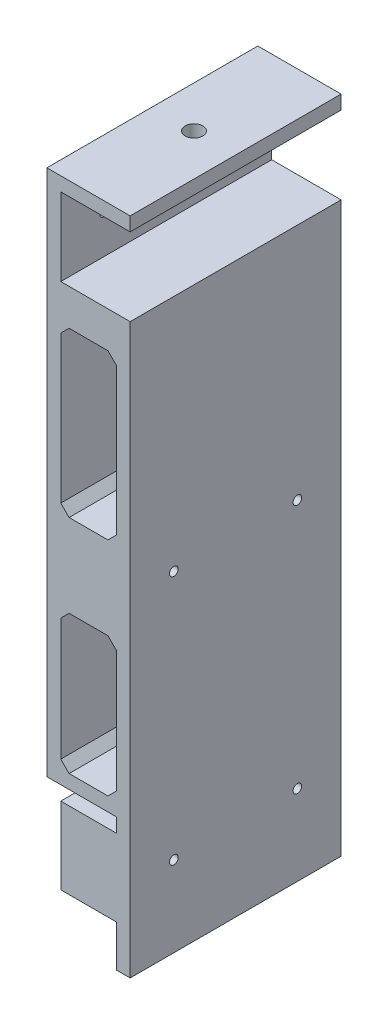
from build123d import *

# Parameters (mm, degrees)
EXTRUDE_1_DEPTH     = 76
CUT_EXTRUDE_1_REACH = 225.743
SKETCH_2_R          = 1.57
CUT_EXTRUDE_2_REACH = 225.743
SKETCH_3_R          = 1.57
CUT_EXTRUDE_3_REACH = 252.262
SKETCH_4_R          = 3.17
CUT_EXTRUDE_4_REACH = 226.356
SKETCH_6_R          = 1.57
CUT_EXTRUDE_5_REACH = 225.029
SKETCH_7_W          = 19.993575714
SKETCH_7_H          = 50
SKETCH_7_H_2        = 59.035578036
CHAMFER_1_SIZE      = 3
CHAMFER_2_SIZE      = 3
CHAMFER_3_SIZE      = 3
CHAMFER_4_SIZE      = 3
CHAMFER_5_SIZE      = 3
CHAMFER_6_SIZE      = 3
CHAMFER_7_SIZE      = 3
CHAMFER_8_SIZE      = 3


with BuildPart() as part:
    # 草图1 → 凸台-拉伸1 (new body)
    with BuildSketch(Plane.XY):
        Polygon((12.5, -13.85), (12.5, -28.85), (7.506424286, -28.85), (7.506424286, -13.85), (-12.5, -13.85), (-12.5, 13.85), (7.506424286, 13.85), (7.506424286, 18.95), (-17.493575714, 18.95), (-17.493575714, 208.95), (12.5, 208.95), (12.5, 203.95), (-12.493575714, 203.95), (-12.493575714, 175.95), (12.5, 175.95), (12.5, 18.95), (12.5, 13.85), align=None)
    extrude(amount=EXTRUDE_1_DEPTH)

    # 草图2 → 切除-拉伸1 (cut, up to next)
    with BuildSketch(Plane(origin=(-12.493575714, 0, 0), x_dir=(0, 0, -1), z_dir=(1, 0, 0)), mode=Mode.PRIVATE) as cut_extrude_1_sk1:
        with Locations((-60.4, 189.95)):
            Circle(SKETCH_2_R)
    cut_extrude_1_tool1 = extrude(cut_extrude_1_sk1.sketch, amount=-CUT_EXTRUDE_1_REACH, mode=Mode.PRIVATE) & part.part
    # 草图2 → 切除-拉伸1 (cut, up to next)
    with BuildSketch(Plane(origin=(-12.493575714, 0, 0), x_dir=(0, 0, -1), z_dir=(1, 0, 0)), mode=Mode.PRIVATE) as cut_extrude_1_sk2:
        with Locations((-15.6, 189.95)):
            Circle(SKETCH_2_R)
    cut_extrude_1_tool2 = extrude(cut_extrude_1_sk2.sketch, amount=-CUT_EXTRUDE_1_REACH, mode=Mode.PRIVATE) & part.part
    add(cut_extrude_1_tool1.solids().sort_by_distance((-12.493576, 189.95, 60.4))[0], mode=Mode.SUBTRACT)
    add(cut_extrude_1_tool2.solids().sort_by_distance((-12.493576, 189.95, 15.6))[0], mode=Mode.SUBTRACT)

    # 草图3 → 切除-拉伸2 (cut, up to next)
    with BuildSketch(Plane.ZY.offset(12.5), mode=Mode.PRIVATE) as cut_extrude_2_sk1:
        with Locations((15.75, 0.15)):
            Circle(SKETCH_3_R)
    cut_extrude_2_tool1 = extrude(cut_extrude_2_sk1.sketch, amount=-CUT_EXTRUDE_2_REACH, mode=Mode.PRIVATE) & part.part
    # 草图3 → 切除-拉伸2 (cut, up to next)
    with BuildSketch(Plane.ZY.offset(12.5), mode=Mode.PRIVATE) as cut_extrude_2_sk2:
        with Locations((60.25, 0.15)):
            Circle(SKETCH_3_R)
    cut_extrude_2_tool2 = extrude(cut_extrude_2_sk2.sketch, amount=-CUT_EXTRUDE_2_REACH, mode=Mode.PRIVATE) & part.part
    add(cut_extrude_2_tool1.solids().sort_by_distance((-12.5, 0.15, 15.75))[0], mode=Mode.SUBTRACT)
    add(cut_extrude_2_tool2.solids().sort_by_distance((-12.5, 0.15, 60.25))[0], mode=Mode.SUBTRACT)

    # 草图4 → 切除-拉伸3 (cut, up to next)
    with BuildSketch(Plane(origin=(0, 208.95, 0), x_dir=(1, 0, 0), z_dir=(0, 1, 0)), mode=Mode.PRIVATE) as cut_extrude_3_sk1:
        with Locations((-2.496787857, -38)):
            Circle(SKETCH_4_R)
    cut_extrude_3_tool1 = extrude(cut_extrude_3_sk1.sketch, amount=-CUT_EXTRUDE_3_REACH, mode=Mode.PRIVATE) & part.part
    add(cut_extrude_3_tool1.solids().sort_by_distance((-2.496788, 208.95, 38))[0], mode=Mode.SUBTRACT)

    # 草图6 → 切除-拉伸4 (cut, up to next)
    with BuildSketch(Plane.ZY.offset(17.493575714), mode=Mode.PRIVATE) as cut_extrude_4_sk1:
        with Locations((15.75, 90.15)):
            Circle(SKETCH_6_R)
    cut_extrude_4_tool1 = extrude(cut_extrude_4_sk1.sketch, amount=-CUT_EXTRUDE_4_REACH, mode=Mode.PRIVATE) & part.part
    # 草图6 → 切除-拉伸4 (cut, up to next)
    with BuildSketch(Plane.ZY.offset(17.493575714), mode=Mode.PRIVATE) as cut_extrude_4_sk2:
        with Locations((60.25, 90.15)):
            Circle(SKETCH_6_R)
    cut_extrude_4_tool2 = extrude(cut_extrude_4_sk2.sketch, amount=-CUT_EXTRUDE_4_REACH, mode=Mode.PRIVATE) & part.part
    add(cut_extrude_4_tool1.solids().sort_by_distance((-17.493576, 90.15, 15.75))[0], mode=Mode.SUBTRACT)
    add(cut_extrude_4_tool2.solids().sort_by_distance((-17.493576, 90.15, 60.25))[0], mode=Mode.SUBTRACT)

    # 草图7 → 切除-拉伸5 (cut, up to next)
    with BuildSketch(Plane.XY.offset(76), mode=Mode.PRIVATE) as cut_extrude_5_sk1:
        with Locations((-2.496787857, 48.95)):
            Rectangle(SKETCH_7_W, SKETCH_7_H)
    cut_extrude_5_tool1 = extrude(cut_extrude_5_sk1.sketch, amount=-CUT_EXTRUDE_5_REACH, mode=Mode.PRIVATE) & part.part
    # 草图7 → 切除-拉伸5 (cut, up to next)
    with BuildSketch(Plane.XY.offset(76), mode=Mode.PRIVATE) as cut_extrude_5_sk2:
        with Locations((-2.496787857, 133.354220203)):
            Rectangle(SKETCH_7_W, SKETCH_7_H_2)
    cut_extrude_5_tool2 = extrude(cut_extrude_5_sk2.sketch, amount=-CUT_EXTRUDE_5_REACH, mode=Mode.PRIVATE) & part.part
    add(cut_extrude_5_tool1.solids().sort_by_distance((-2.496788, 48.95, 76))[0], mode=Mode.SUBTRACT)
    add(cut_extrude_5_tool2.solids().sort_by_distance((-2.496788, 133.35422, 76))[0], mode=Mode.SUBTRACT)

    # Chamfer 1
    chamfer_1_edges = [part.edges().sort_by_distance(p)[0] for p in [
        (-12.493575714, 162.872009221, 38),
    ]]
    chamfer(chamfer_1_edges, length=CHAMFER_1_SIZE)

    # Chamfer 2
    chamfer_2_edges = [part.edges().sort_by_distance(p)[0] for p in [
        (7.5, 103.836431185, 38),
    ]]
    chamfer(chamfer_2_edges, length=CHAMFER_2_SIZE)

    # Chamfer 3
    chamfer_3_edges = [part.edges().sort_by_distance(p)[0] for p in [
        (-12.493575714, 73.95, 38),
    ]]
    chamfer(chamfer_3_edges, length=CHAMFER_3_SIZE)

    # Chamfer 4
    chamfer_4_edges = [part.edges().sort_by_distance(p)[0] for p in [
        (7.5, 23.95, 38),
    ]]
    chamfer(chamfer_4_edges, length=CHAMFER_4_SIZE)

    # Chamfer 5
    chamfer_5_edges = [part.edges().sort_by_distance(p)[0] for p in [
        (-12.493575714, 23.95, 38),
    ]]
    chamfer(chamfer_5_edges, length=CHAMFER_5_SIZE)

    # Chamfer 6
    chamfer_6_edges = [part.edges().sort_by_distance(p)[0] for p in [
        (7.5, 73.95, 38),
    ]]
    chamfer(chamfer_6_edges, length=CHAMFER_6_SIZE)

    # Chamfer 7
    chamfer_7_edges = [part.edges().sort_by_distance(p)[0] for p in [
        (7.5, 162.872009221, 38),
    ]]
    chamfer(chamfer_7_edges, length=CHAMFER_7_SIZE)

    # Chamfer 8
    chamfer_8_edges = [part.edges().sort_by_distance(p)[0] for p in [
        (-12.493575714, 103.836431185, 38),
    ]]
    chamfer(chamfer_8_edges, length=CHAMFER_8_SIZE)


solid = part.part
